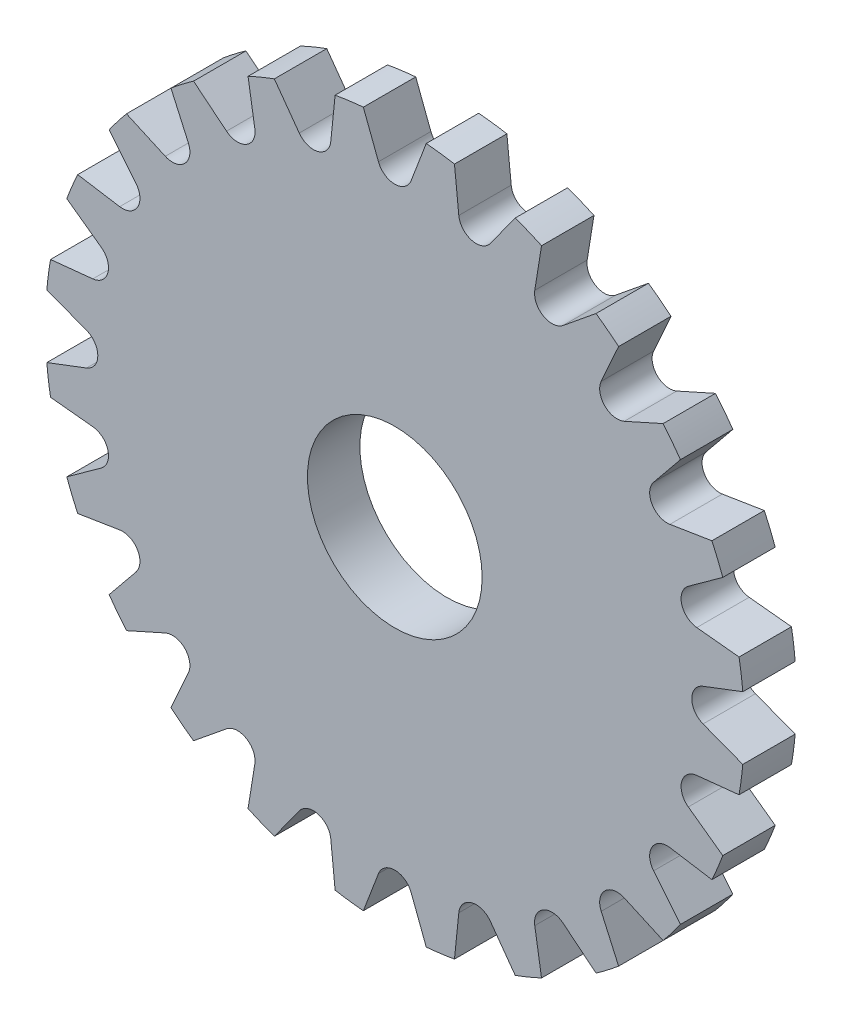
from build123d import *

# Parameters (mm, degrees)
SKETCH1_R           = 40
SKETCH1_R_2         = 10
BOSS_EXTRUDE1_DEPTH = 6
CUT_EXTRUDE1_START  = -6
CUT_EXTRUDE1_DEPTH  = 6
CIRPATTERN1_DEPTH   = 6


# Read off the part's stored shape, not the designer's step: CirPattern1
with BuildPart() as part:
    # Sketch1 → Boss-Extrude1 (new body)
    with BuildSketch(Plane.XY):
        Circle(SKETCH1_R)
        Circle(SKETCH1_R_2, mode=Mode.SUBTRACT)
    extrude(amount=BOSS_EXTRUDE1_DEPTH)

    # Sketch2 → Cut-Extrude1 (cut)
    with BuildSketch(Plane.XY.offset(6).offset(CUT_EXTRUDE1_START)):
        with BuildLine():
            Line((-3.601715358, 39.837515566), (-1.869030862, 35.288154767))
            ThreePointArc((-1.869030862, 35.288154767), (0, 34), (1.869030862, 35.288154767))
            Line((1.869030862, 35.288154767), (3.601715358, 39.837515566))
            ThreePointArc((3.601715358, 39.837515566), (0, 40), (-3.601715358, 39.837515566))
        make_face()
    extrude(amount=CUT_EXTRUDE1_DEPTH, mode=Mode.SUBTRACT)

    # CirPattern1 outline → CirPattern1 (cut)
    with BuildSketch(Plane.XY):
        with BuildLine():
            Line((-13.789697621, 37.547892611), (-10.9385917, 33.601999269))
            ThreePointArc((-10.9385917, 33.601999269), (-8.799847533, 32.841478094), (-7.32790134, 34.569480835))
            Line((-7.32790134, 34.569480835), (-6.831717855, 39.41227767))
            ThreePointArc((-6.831717855, 39.41227767), (-10.352761804, 38.637033051), (-13.789697621, 37.547892611))
        make_face()
        with BuildLine():
            Line((10.9385917, 33.601999269), (13.789697621, 37.547892611))
            ThreePointArc((13.789697621, 37.547892611), (10.352761804, 38.637033051), (6.831717855, 39.41227767))
            Line((6.831717855, 39.41227767), (7.32790134, 34.569480835))
            ThreePointArc((7.32790134, 34.569480835), (8.799847533, 32.841478094), (10.9385917, 33.601999269))
        make_face()
        with BuildLine():
            Line((19.262705591, 29.62592305), (23.03793478, 32.699442825))
            ThreePointArc((23.03793478, 32.699442825), (20, 34.641016151), (16.799580786, 36.301158183))
            Line((16.799580786, 36.301158183), (16.025449176, 31.494953912))
            ThreePointArc((16.025449176, 31.494953912), (17, 29.444863729), (19.262705591, 29.62592305))
        make_face()
        with BuildLine():
            Line((26.274097929, 23.630889134), (30.716174756, 25.622580049))
            ThreePointArc((30.716174756, 25.622580049), (28.284271247, 28.284271247), (25.622580049, 30.716174756))
            Line((25.622580049, 30.716174756), (23.630889134, 26.274097929))
            ThreePointArc((23.630889134, 26.274097929), (24.04163056, 24.04163056), (26.274097929, 23.630889134))
        make_face()
        with BuildLine():
            Line((31.494953912, 16.025449176), (36.301158183, 16.799580786))
            ThreePointArc((36.301158183, 16.799580786), (34.641016151, 20), (32.699442825, 23.03793478))
            Line((32.699442825, 23.03793478), (29.62592305, 19.262705591))
            ThreePointArc((29.62592305, 19.262705591), (29.444863729, 17), (31.494953912, 16.025449176))
        make_face()
        with BuildLine():
            Line((34.569480835, 7.32790134), (39.41227767, 6.831717855))
            ThreePointArc((39.41227767, 6.831717855), (38.637033052, 10.352761804), (37.547892611, 13.789697621))
            Line((37.547892611, 13.789697621), (33.601999269, 10.9385917))
            ThreePointArc((33.601999269, 10.9385917), (32.841478094, 8.799847533), (34.569480835, 7.32790134))
        make_face()
        with BuildLine():
            Line((35.288154767, -1.869030862), (39.837515566, -3.601715358))
            ThreePointArc((39.837515566, -3.601715358), (40, 0), (39.837515566, 3.601715358))
            Line((39.837515566, 3.601715358), (35.288154767, 1.869030862))
            ThreePointArc((35.288154767, 1.869030862), (34, 0), (35.288154767, -1.869030862))
        make_face()
        with BuildLine():
            Line((33.601999269, -10.9385917), (37.547892611, -13.789697621))
            ThreePointArc((37.547892611, -13.789697621), (38.637033052, -10.352761804), (39.41227767, -6.831717855))
            Line((39.41227767, -6.831717855), (34.569480835, -7.32790134))
            ThreePointArc((34.569480835, -7.32790134), (32.841478094, -8.799847533), (33.601999269, -10.9385917))
        make_face()
        with BuildLine():
            Line((29.62592305, -19.262705591), (32.699442825, -23.03793478))
            ThreePointArc((32.699442825, -23.03793478), (34.641016151, -20), (36.301158183, -16.799580786))
            Line((36.301158183, -16.799580786), (31.494953912, -16.025449176))
            ThreePointArc((31.494953912, -16.025449176), (29.444863729, -17), (29.62592305, -19.262705591))
        make_face()
        with BuildLine():
            Line((23.630889134, -26.274097929), (25.622580049, -30.716174756))
            ThreePointArc((25.622580049, -30.716174756), (28.284271247, -28.284271247), (30.716174756, -25.622580049))
            Line((30.716174756, -25.622580049), (26.274097929, -23.630889134))
            ThreePointArc((26.274097929, -23.630889134), (24.04163056, -24.04163056), (23.630889134, -26.274097929))
        make_face()
        with BuildLine():
            Line((16.025449176, -31.494953912), (16.799580786, -36.301158183))
            ThreePointArc((16.799580786, -36.301158183), (20, -34.641016151), (23.03793478, -32.699442825))
            Line((23.03793478, -32.699442825), (19.262705591, -29.62592305))
            ThreePointArc((19.262705591, -29.62592305), (17, -29.444863729), (16.025449176, -31.494953912))
        make_face()
        with BuildLine():
            Line((7.32790134, -34.569480835), (6.831717855, -39.41227767))
            ThreePointArc((6.831717855, -39.41227767), (10.352761804, -38.637033052), (13.789697621, -37.547892611))
            Line((13.789697621, -37.547892611), (10.9385917, -33.601999269))
            ThreePointArc((10.9385917, -33.601999269), (8.799847533, -32.841478094), (7.32790134, -34.569480835))
        make_face()
        with BuildLine():
            Line((-1.869030862, -35.288154767), (-3.601715358, -39.837515566))
            ThreePointArc((-3.601715358, -39.837515566), (0, -40), (3.601715358, -39.837515566))
            Line((3.601715358, -39.837515566), (1.869030862, -35.288154767))
            ThreePointArc((1.869030862, -35.288154767), (0, -34), (-1.869030862, -35.288154767))
        make_face()
        with BuildLine():
            Line((-10.9385917, -33.601999269), (-13.789697621, -37.547892611))
            ThreePointArc((-13.789697621, -37.547892611), (-10.352761804, -38.637033052), (-6.831717855, -39.41227767))
            Line((-6.831717855, -39.41227767), (-7.32790134, -34.569480835))
            ThreePointArc((-7.32790134, -34.569480835), (-8.799847533, -32.841478094), (-10.9385917, -33.601999269))
        make_face()
        with BuildLine():
            Line((-19.262705591, -29.62592305), (-23.03793478, -32.699442825))
            ThreePointArc((-23.03793478, -32.699442825), (-20, -34.641016151), (-16.799580786, -36.301158183))
            Line((-16.799580786, -36.301158183), (-16.025449176, -31.494953912))
            ThreePointArc((-16.025449176, -31.494953912), (-17, -29.444863729), (-19.262705591, -29.62592305))
        make_face()
        with BuildLine():
            Line((-26.274097929, -23.630889134), (-30.716174756, -25.622580049))
            ThreePointArc((-30.716174756, -25.622580049), (-28.284271247, -28.284271247), (-25.622580049, -30.716174756))
            Line((-25.622580049, -30.716174756), (-23.630889134, -26.274097929))
            ThreePointArc((-23.630889134, -26.274097929), (-24.04163056, -24.04163056), (-26.274097929, -23.630889134))
        make_face()
        with BuildLine():
            Line((-31.494953912, -16.025449176), (-36.301158183, -16.799580786))
            ThreePointArc((-36.301158183, -16.799580786), (-34.641016151, -20), (-32.699442825, -23.03793478))
            Line((-32.699442825, -23.03793478), (-29.62592305, -19.262705591))
            ThreePointArc((-29.62592305, -19.262705591), (-29.444863729, -17), (-31.494953912, -16.025449176))
        make_face()
        with BuildLine():
            Line((-34.569480835, -7.32790134), (-39.41227767, -6.831717855))
            ThreePointArc((-39.41227767, -6.831717855), (-38.637033052, -10.352761804), (-37.547892611, -13.789697621))
            Line((-37.547892611, -13.789697621), (-33.601999269, -10.9385917))
            ThreePointArc((-33.601999269, -10.9385917), (-32.841478094, -8.799847533), (-34.569480835, -7.32790134))
        make_face()
        with BuildLine():
            Line((-35.288154767, 1.869030862), (-39.837515566, 3.601715358))
            ThreePointArc((-39.837515566, 3.601715358), (-40, 0), (-39.837515566, -3.601715358))
            Line((-39.837515566, -3.601715358), (-35.288154767, -1.869030862))
            ThreePointArc((-35.288154767, -1.869030862), (-34, 0), (-35.288154767, 1.869030862))
        make_face()
        with BuildLine():
            Line((-33.601999269, 10.9385917), (-37.547892611, 13.789697621))
            ThreePointArc((-37.547892611, 13.789697621), (-38.637033052, 10.352761804), (-39.41227767, 6.831717855))
            Line((-39.41227767, 6.831717855), (-34.569480835, 7.32790134))
            ThreePointArc((-34.569480835, 7.32790134), (-32.841478094, 8.799847533), (-33.601999269, 10.9385917))
        make_face()
        with BuildLine():
            Line((-29.62592305, 19.262705591), (-32.699442825, 23.03793478))
            ThreePointArc((-32.699442825, 23.03793478), (-34.641016151, 20), (-36.301158183, 16.799580786))
            Line((-36.301158183, 16.799580786), (-31.494953912, 16.025449176))
            ThreePointArc((-31.494953912, 16.025449176), (-29.444863729, 17), (-29.62592305, 19.262705591))
        make_face()
        with BuildLine():
            Line((-23.630889134, 26.274097929), (-25.622580049, 30.716174756))
            ThreePointArc((-25.622580049, 30.716174756), (-28.284271247, 28.284271247), (-30.716174756, 25.622580049))
            Line((-30.716174756, 25.622580049), (-26.274097929, 23.630889134))
            ThreePointArc((-26.274097929, 23.630889134), (-24.04163056, 24.04163056), (-23.630889134, 26.274097929))
        make_face()
        with BuildLine():
            Line((-16.025449176, 31.494953912), (-16.799580786, 36.301158183))
            ThreePointArc((-16.799580786, 36.301158183), (-20, 34.641016151), (-23.03793478, 32.699442825))
            Line((-23.03793478, 32.699442825), (-19.262705591, 29.62592305))
            ThreePointArc((-19.262705591, 29.62592305), (-17, 29.444863729), (-16.025449176, 31.494953912))
        make_face()
    extrude(amount=CIRPATTERN1_DEPTH, mode=Mode.SUBTRACT)


solid = part.part
